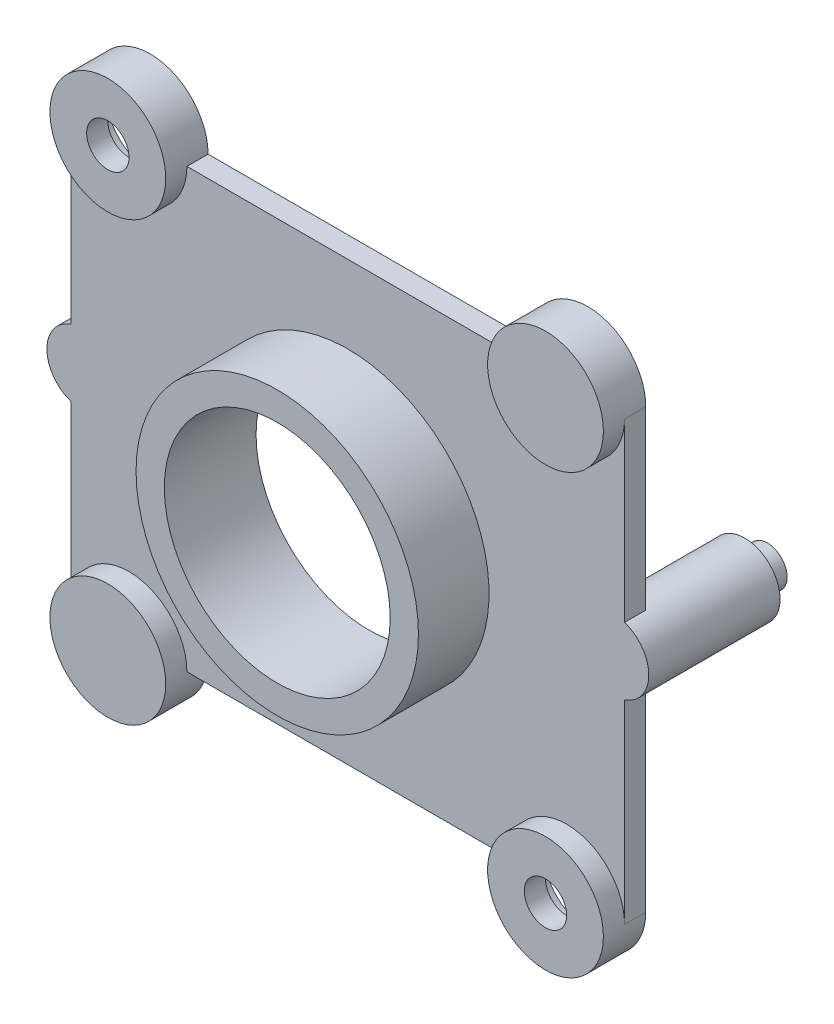
from build123d import *
from build123d.topology import SkipClean

# Parameters (mm, degrees)
SKETCH1_R      = 3.1
EXTRUDE1_DEPTH = 1.5
SKETCH2_R      = 4.1
SKETCH2_R_2    = 1.5
EXTRUDE2_DEPTH = 1.5
EXTRUDE3_START = 7.8
SKETCH3_R      = 2.5
EXTRUDE3_DEPTH = 7.8
SKETCH4_R      = 1.4
EXTRUDE4_DEPTH = 1.6
SKETCH5_R      = 8
EXTRUDE5_DEPTH = 31.443100442
SKETCH6_R      = 10
SKETCH6_R_2    = 8
EXTRUDE6_DEPTH = 5


with BuildPart() as part:
    # Sketch1 → Extrude1 (new body)
    with BuildSketch(Plane.XY):
        with BuildLine():
            Line((-11.4, 15.5), (11.4, 15.5))
            ThreePointArc((11.4, 15.5), (15.5, 19.6), (19.6, 15.5))
            Line((19.6, 15.5), (19.6, 3.03001766))
            ThreePointArc((19.6, 3.03001766), (21.313431552, 0.656979507), (19.6, -1.716058647))
            Line((19.6, -1.716058647), (19.6, -15.5))
            ThreePointArc((19.6, -15.5), (15.5, -19.6), (11.4, -15.5))
            Line((11.4, -15.5), (-11.4, -15.5))
            ThreePointArc((-11.4, -15.5), (-15.5, -19.6), (-19.6, -15.5))
            Line((-19.6, -15.5), (-19.6, -3.03001766))
            ThreePointArc((-19.6, -3.03001766), (-21.313431552, -0.656979507), (-19.6, 1.716058647))
            Line((-19.6, 1.716058647), (-19.6, 15.5))
            ThreePointArc((-19.6, 15.5), (-15.5, 19.6), (-11.4, 15.5))
        make_face()
        with Locations((15.5, -15.5)):
            Circle(SKETCH1_R, mode=Mode.SUBTRACT)
        with Locations((-15.5, 15.5)):
            Circle(SKETCH1_R, mode=Mode.SUBTRACT)
        with BuildLine():
            Line((-12.40645834, -15.3), (-18.59354166, -15.3))
            ThreePointArc((-18.59354166, -15.3), (-15.5, -18.6), (-12.40645834, -15.3))
        make_face(mode=Mode.SUBTRACT)
        with BuildLine():
            Line((18.59354166, 15.3), (12.40645834, 15.3))
            ThreePointArc((12.40645834, 15.3), (15.5, 18.6), (18.59354166, 15.3))
        make_face(mode=Mode.SUBTRACT)
    extrude(amount=EXTRUDE1_DEPTH)

    # Sketch2 → Extrude2 (add)
    # profile 1 of 4: a face of its own
    with SkipClean():  # the faces are left unmerged after this step: merging them gives an invalid solid
        with BuildSketch(Plane.XY.offset(1.5)):
            with Locations((-15.5, 15.5)):
                Circle(SKETCH2_R)
            with Locations((-15.5, 15.5)):
                Circle(SKETCH2_R_2, mode=Mode.SUBTRACT)
        # profile 2 of 4: a face of its own
        with BuildSketch(Plane.XY.offset(1.5)):
            with Locations((15.5, 15.5)):
                Circle(SKETCH2_R)
        # profile 3 of 4: a face of its own
        with BuildSketch(Plane.XY.offset(1.5)):
            with Locations((15.5, -15.5)):
                Circle(SKETCH2_R)
            with Locations((15.5, -15.5)):
                Circle(SKETCH2_R_2, mode=Mode.SUBTRACT)
        # profile 4 of 4: a face of its own
        with BuildSketch(Plane.XY.offset(1.5)):
            with Locations((-15.5, -15.5)):
                Circle(SKETCH2_R)
        extrude(amount=EXTRUDE2_DEPTH)
    add(part.part.scale(1), mode=Mode.REPLACE)  # the faces are merged on a copy

    # Sketch3 → Extrude3 (add)
    with BuildSketch(Plane(origin=(0, 0, 0), x_dir=(-1, 0, 0), z_dir=(0, 0, -1)).offset(EXTRUDE3_START)):
        with Locations((18.813431552, -0.656979507)):
            Circle(SKETCH3_R)
        with Locations((-18.813431552, 0.656979507)):
            Circle(SKETCH3_R)
    extrude(amount=-EXTRUDE3_DEPTH)

    # Sketch4 → Extrude4 (add)
    with BuildSketch(Plane(origin=(0, 0, -7.8), x_dir=(-1, 0, 0), z_dir=(0, 0, -1))):
        with Locations((-18.813431552, 0.656979507)):
            Circle(SKETCH4_R)
        with Locations((18.813431552, -0.656979507)):
            Circle(SKETCH4_R)
    extrude(amount=EXTRUDE4_DEPTH)

    # Sketch5 → Extrude5 (cut, through all)
    with BuildSketch(Plane(origin=(0, 0, 0), x_dir=(-1, 0, 0), z_dir=(0, 0, -1))):
        Circle(SKETCH5_R)
    extrude(amount=-EXTRUDE5_DEPTH, mode=Mode.SUBTRACT)

    # Sketch6 → Extrude6 (add)
    with SkipClean():  # the faces are left unmerged after this step: merging them gives an invalid solid
        with BuildSketch(Plane.XY.offset(1.5)):
            Circle(SKETCH6_R)
            Circle(SKETCH6_R_2, mode=Mode.SUBTRACT)
        extrude(amount=EXTRUDE6_DEPTH)


solid = part.part
